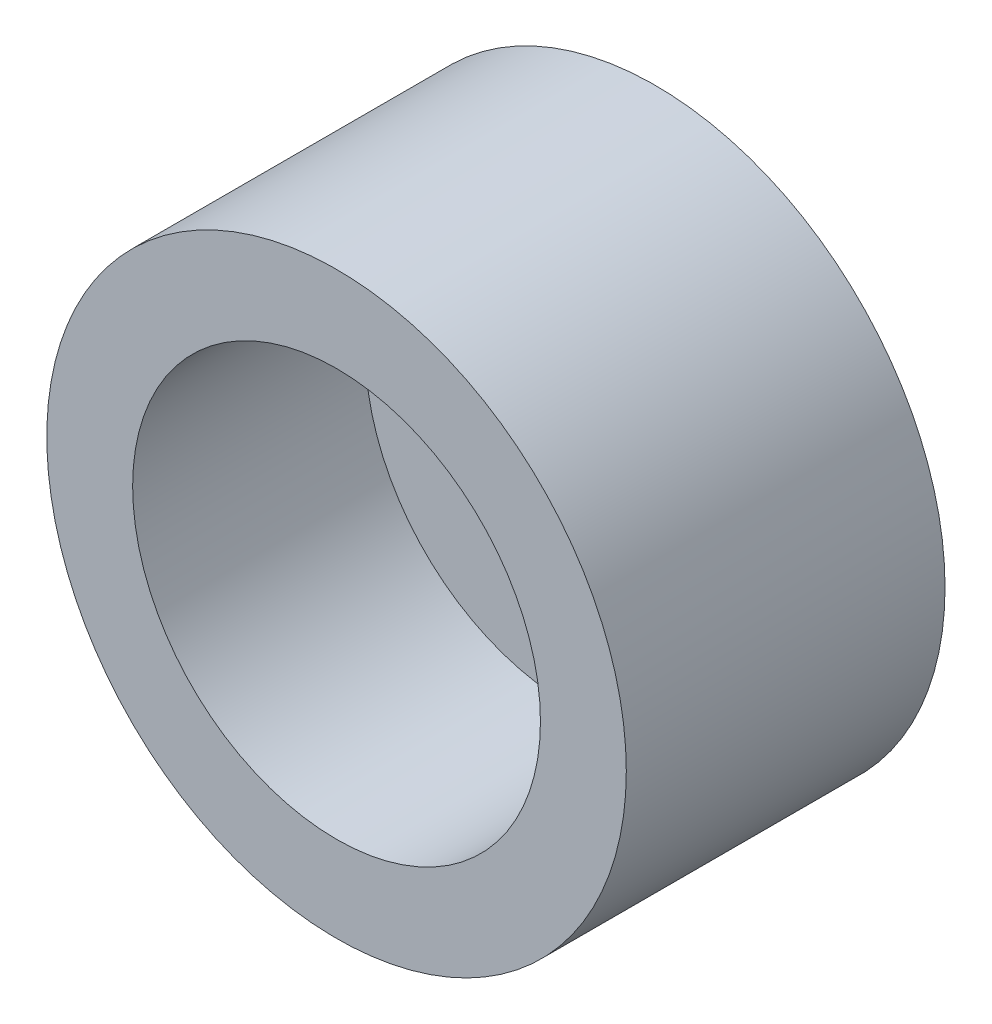
from build123d import *

# Parameters (mm, degrees)
SKETCH2_R           = 7.5
BOSS_EXTRUDE1_DEPTH = 2
SKETCH3_R           = 7.5
SKETCH3_R_2         = 4.75
BOSS_EXTRUDE2_DEPTH = 5.425
SKETCH4_R           = 7.5
SKETCH4_R_2         = 6.75
CUT_EXTRUDE1_DEPTH  = 13.947224606


with BuildPart() as part:
    # Sketch2 → Boss-Extrude1 (new body)
    with BuildSketch(Plane.XY):
        Circle(SKETCH2_R)
    extrude(amount=BOSS_EXTRUDE1_DEPTH)

    # Sketch3 → Boss-Extrude2 (add)
    with BuildSketch(Plane.XY.offset(2)):
        Circle(SKETCH3_R)
        Circle(SKETCH3_R_2, mode=Mode.SUBTRACT)
    extrude(amount=BOSS_EXTRUDE2_DEPTH)

    # Sketch4 → Cut-Extrude1 (cut, through all)
    with BuildSketch(Plane.XY.offset(7.425)):
        Circle(SKETCH4_R)
        Circle(SKETCH4_R_2, mode=Mode.SUBTRACT)
    extrude(amount=-CUT_EXTRUDE1_DEPTH, mode=Mode.SUBTRACT)


solid = part.part
